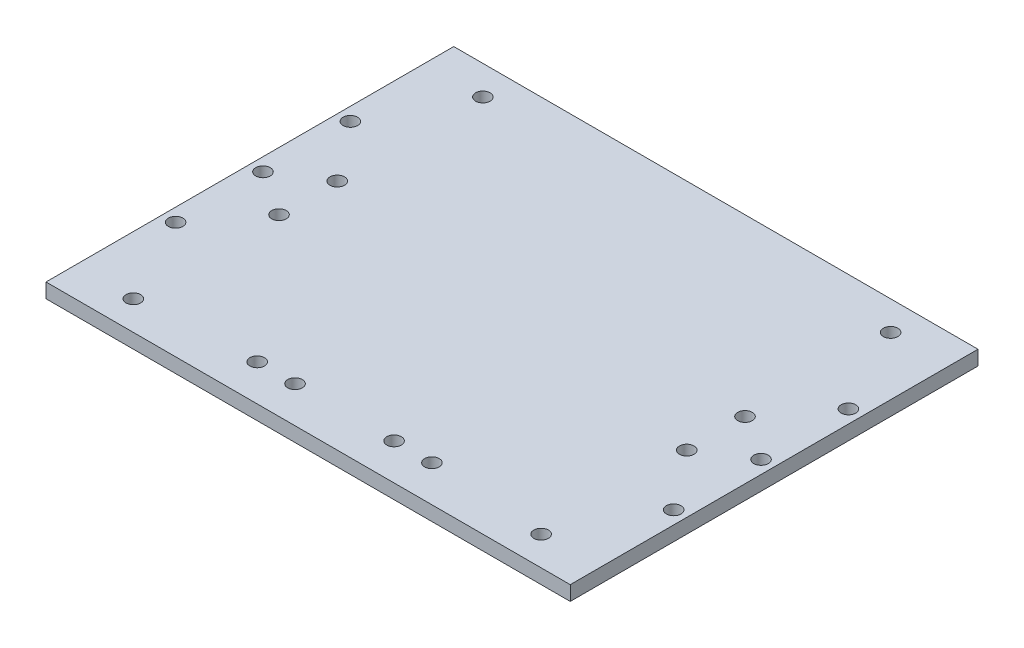
from build123d import *

# Parameters (mm, degrees)
SKETCH2_W           = 228.6
SKETCH2_H           = 177.8
SKETCH2_R           = 3.175
BOSS_EXTRUDE1_DEPTH = 6.35


with BuildPart() as part:
    # Sketch2 → Boss-Extrude1 (new body)
    with BuildSketch(Plane(origin=(0, 0, 0), x_dir=(1, 0, 0), z_dir=(0, 1, 0))):
        Rectangle(SKETCH2_W, SKETCH2_H)
        with Locations((-21.59, -73.025)):
            Circle(SKETCH2_R, mode=Mode.SUBTRACT)
        with Locations((-108.585, 0)):
            Circle(SKETCH2_R, mode=Mode.SUBTRACT)
        with Locations((-108.585, -38.1)):
            Circle(SKETCH2_R, mode=Mode.SUBTRACT)
        with Locations((-108.585, 38.1)):
            Circle(SKETCH2_R, mode=Mode.SUBTRACT)
        with Locations((108.585, -38.1)):
            Circle(SKETCH2_R, mode=Mode.SUBTRACT)
        with Locations((108.585, 0)):
            Circle(SKETCH2_R, mode=Mode.SUBTRACT)
        with Locations((108.585, 38.1)):
            Circle(SKETCH2_R, mode=Mode.SUBTRACT)
        with Locations((-38.1, -73.025)):
            Circle(SKETCH2_R, mode=Mode.SUBTRACT)
        with Locations((38.1, -73.025)):
            Circle(SKETCH2_R, mode=Mode.SUBTRACT)
        with Locations((21.59, -73.025)):
            Circle(SKETCH2_R, mode=Mode.SUBTRACT)
        with Locations((88.9, -76.2)):
            Circle(SKETCH2_R, mode=Mode.SUBTRACT)
        with Locations((88.9, -12.7)):
            Circle(SKETCH2_R, mode=Mode.SUBTRACT)
        with Locations((88.9, 76.2)):
            Circle(SKETCH2_R, mode=Mode.SUBTRACT)
        with Locations((88.9, 12.7)):
            Circle(SKETCH2_R, mode=Mode.SUBTRACT)
        with Locations((-88.9, 76.2)):
            Circle(SKETCH2_R, mode=Mode.SUBTRACT)
        with Locations((-88.9, 12.7)):
            Circle(SKETCH2_R, mode=Mode.SUBTRACT)
        with Locations((-88.9, -12.7)):
            Circle(SKETCH2_R, mode=Mode.SUBTRACT)
        with Locations((-88.9, -76.2)):
            Circle(SKETCH2_R, mode=Mode.SUBTRACT)
    extrude(amount=BOSS_EXTRUDE1_DEPTH)


solid = part.part
